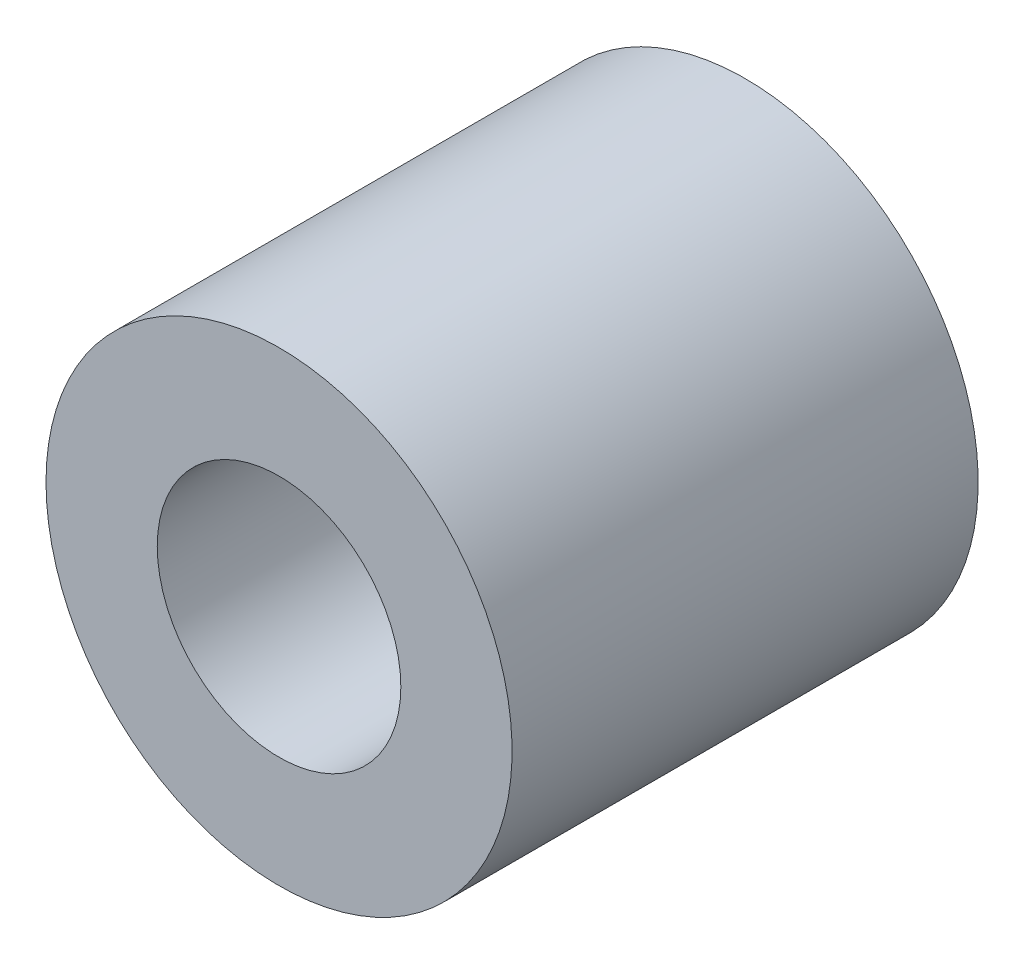
from build123d import *

# Parameters (mm, degrees)
SKETCH1_R           = 4.7625
SKETCH1_R_2         = 2.4892
BOSS_EXTRUDE1_DEPTH = 9.525


with BuildPart() as part:
    # Sketch1 → Boss-Extrude1 (new body)
    with BuildSketch(Plane.XY):
        Circle(SKETCH1_R)
        Circle(SKETCH1_R_2, mode=Mode.SUBTRACT)
    extrude(amount=BOSS_EXTRUDE1_DEPTH)


solid = part.part
